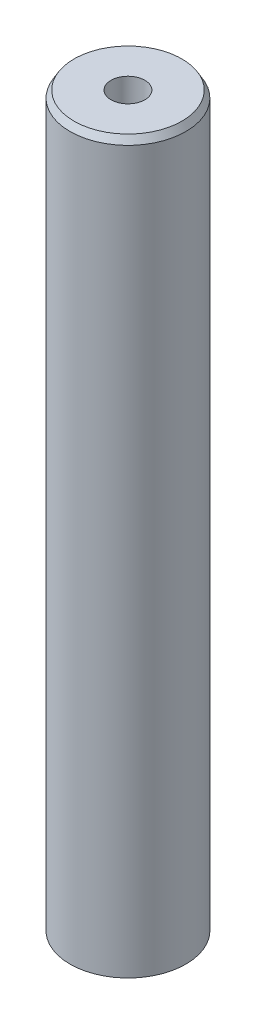
from build123d import *
from OCP.BRepFilletAPI import BRepFilletAPI_MakeChamfer

# Parameters (mm, degrees)
SKETCH1_R           = 47.5
BOSS_EXTRUDE1_DEPTH = 600
SKETCH2_R           = 13.877057119
CUT_EXTRUDE1_DEPTH  = 604.748706003
CHAMFER1_SIZE       = 5.692353569
CHAMFER1_SIZE2      = 3.286481865


with BuildPart() as part:
    # Sketch1 → Boss-Extrude1 (new body)
    with BuildSketch(Plane(origin=(0, 0, 0), x_dir=(1, 0, 0), z_dir=(0, 1, 0))):
        Circle(SKETCH1_R)
    extrude(amount=BOSS_EXTRUDE1_DEPTH)

    # Sketch2 → Cut-Extrude1 (cut, through all)
    with BuildSketch(Plane(origin=(0, 0, 0), x_dir=(1, 0, 0), z_dir=(0, 1, 0))):
        Circle(SKETCH2_R)
    extrude(amount=CUT_EXTRUDE1_DEPTH, mode=Mode.SUBTRACT)

    # Chamfer1: one chamfer whose edges measure the first distance from different faces: ONE call of the kernel's chamfer builder (chamfer() names one face for all edges)
    chamfer1_edges_1 = [part.edges().sort_by_distance(p)[0] for p in [
        (-47.5, 600, 0),
    ]]
    chamfer1_side_1 = [part.faces().sort_by_distance(p)[0] for p in [
        (-47.5, 300, 0),
    ]]
    chamfer1_edges_2 = [part.edges().sort_by_distance(p)[0] for p in [
        (-47.5, 0, 0),
    ]]
    chamfer1_side_2 = [part.faces().sort_by_distance(p)[0] for p in [
        (-46.156497116, 0, 0),
    ]]
    chamfer1 = BRepFilletAPI_MakeChamfer(part.part.solid().wrapped)
    for e in chamfer1_edges_1:
        chamfer1.Add(CHAMFER1_SIZE, CHAMFER1_SIZE2, e.wrapped, chamfer1_side_1[0].wrapped)  # the first distance lies on this face
    for e in chamfer1_edges_2:
        chamfer1.Add(CHAMFER1_SIZE, CHAMFER1_SIZE2, e.wrapped, chamfer1_side_2[0].wrapped)  # the first distance lies on this face
    add(Compound.cast(chamfer1.Shape()), mode=Mode.REPLACE)


solid = part.part
